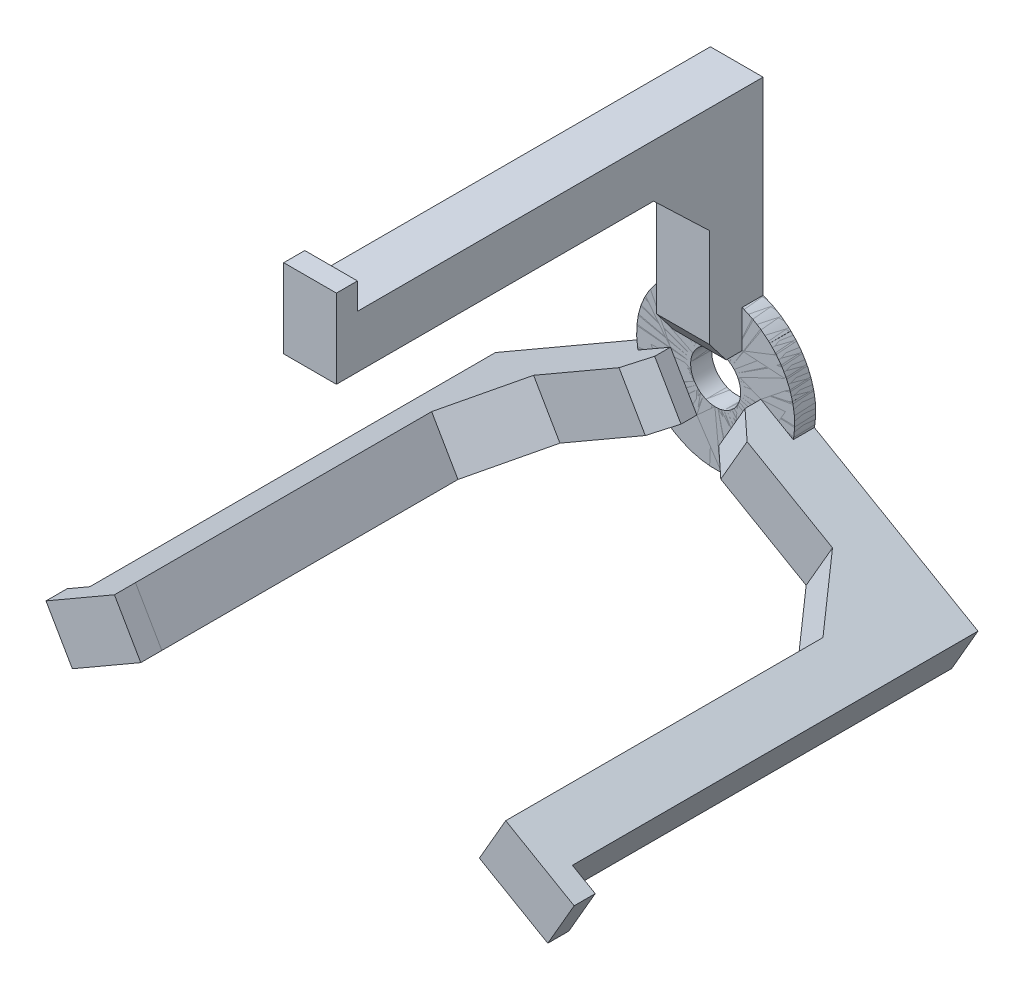
from build123d import *

# Parameters (mm, degrees)
SKETCH1_R                = 4.75
BOSS_EXTRUDE1_DEPTH      = 4
BOSS_EXTRUDE3_DEPTH      = 3
BOSS_EXTRUDE3_DEPTH_BACK = 2
SKETCH2_W                = 10
SKETCH2_H                = 3.269716928
SKETCH6_W                = 10
SKETCH6_H                = 15
BOSS_EXTRUDE4_DEPTH      = 4
BOSS_EXTRUDE5_DEPTH      = 10
CIRPATTERN1_COUNT        = 3
SKETCH9_W                = 3
SKETCH9_H                = 7.38627877
CUT_EXTRUDE2_DEPTH       = 2


with BuildPart() as part:
    # Sketch1 → Boss-Extrude1 (new body)
    with BuildSketch(Plane.XY):
        with BuildLine():
            Line((10.293556018, 10.910669297), (-10.293556018, 10.910669297))
            ThreePointArc((-10.293556018, 10.910669297), (-5.941239758, -13.773222939), (15, 0))
            ThreePointArc((15, 0), (13.773222939, 5.941239758), (10.293556018, 10.910669297))
        make_face()
        Circle(SKETCH1_R, mode=Mode.SUBTRACT)
    extrude(amount=BOSS_EXTRUDE1_DEPTH)

    # Sketch2 → Boss-Extrude3 (add, two sides: drawn at the far end of the back side and taken through both)
    with BuildSketch(Plane.XY.offset(4).offset(-BOSS_EXTRUDE3_DEPTH_BACK)):
        with Locations((0, 8.652125422)):
            Rectangle(SKETCH2_W, SKETCH2_H)
    extrude(amount=BOSS_EXTRUDE3_DEPTH + BOSS_EXTRUDE3_DEPTH_BACK)



with BuildPart() as body_2:
    # Sketch6 → Boss-Extrude4 (new body)
    with BuildSketch(Plane.XY.offset(81)):
        with Locations((0, 47.5)):
            Rectangle(SKETCH6_W, SKETCH6_H)
    extrude(amount=-BOSS_EXTRUDE4_DEPTH)


with BuildPart() as part_1:
    add(part.part)

    add(body_2.part)  # Boss-Extrude5 merges body 2
    # Sketch7 → Boss-Extrude5 (add)
    with BuildSketch(Plane.ZY.offset(5)):
        Polygon((77, 40.003334972), (20.773895041, 40.003334972), (10.189717929, 29.874391285), (10.189717929, 11.156885374), (7, 7.017266958), (0, 7.017266958), (0, 10.910669297), (0, 50.003334972), (77, 50.003334972), align=None)
    extrude(amount=-BOSS_EXTRUDE5_DEPTH)


with BuildPart() as cirpattern1_1:
    # CirPattern1: pattern copy
    add(part_1.part.rotate(Axis((0, 0, 4), (0, 0, 1)), 1 * 360 / CIRPATTERN1_COUNT))


with BuildPart() as cirpattern1_2:
    # CirPattern1: pattern copy
    add(part_1.part.rotate(Axis((0, 0, 4), (0, 0, 1)), 2 * 360 / CIRPATTERN1_COUNT))


with BuildPart() as cut_extrude2_tool:
    # Sketch9 → Cut-Extrude2 (new body)
    with BuildSketch(Plane(origin=(0, 0, 0), x_dir=(-1, 0, 0), z_dir=(0, 0, -1))):
        with Locations((0, 11.405341122)):
            Rectangle(SKETCH9_W, SKETCH9_H)
    extrude(amount=-CUT_EXTRUDE2_DEPTH)


with BuildPart() as part_2:
    add(part_1.part)

    # Cut-Extrude2: cut by cut_extrude2_tool
    add(cut_extrude2_tool.part, mode=Mode.SUBTRACT)


with BuildPart() as cirpattern1_1_1:
    add(cirpattern1_1.part)

    # Cut-Extrude2: cut by cut_extrude2_tool
    add(cut_extrude2_tool.part, mode=Mode.SUBTRACT)


with BuildPart() as cirpattern1_2_1:
    add(cirpattern1_2.part)

    # Cut-Extrude2: cut by cut_extrude2_tool
    add(cut_extrude2_tool.part, mode=Mode.SUBTRACT)


solid = Compound([part_2.part, cirpattern1_1_1.part, cirpattern1_2_1.part])
